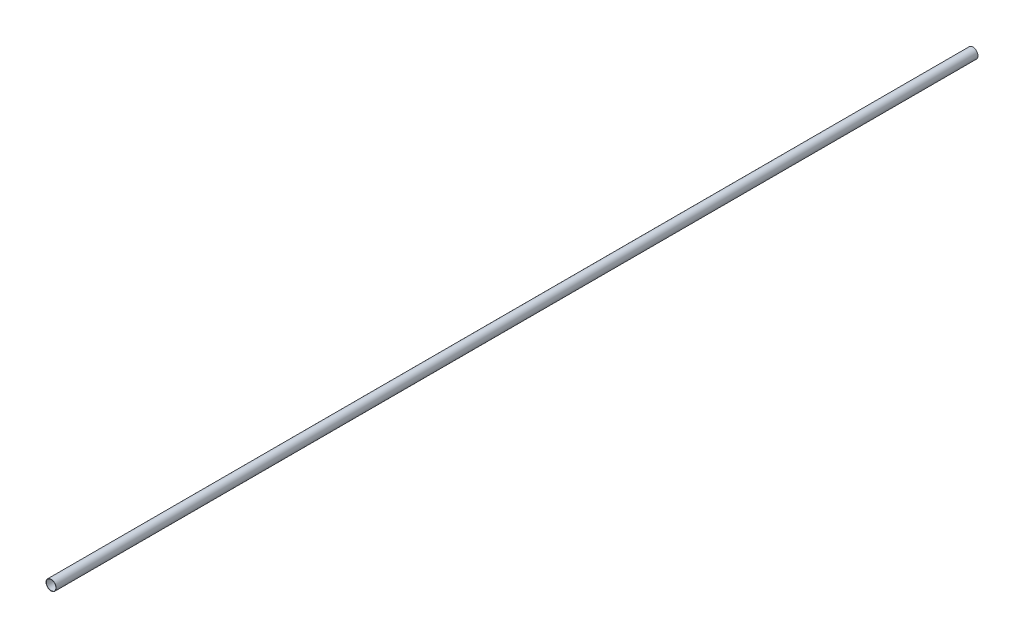
from build123d import *

# Parameters (mm, degrees)
SKETCH1_R           = 4.572
SKETCH1_R_2         = 4.318
BOSS_EXTRUDE1_DEPTH = 825.5


with BuildPart() as part:
    # Sketch1 → Boss-Extrude1 (new body)
    with BuildSketch(Plane.XY):
        with Locations((-112.482767201, -112.482767201)):
            Circle(SKETCH1_R)
        with Locations((-112.482767201, -112.482767201)):
            Circle(SKETCH1_R_2, mode=Mode.SUBTRACT)
    extrude(amount=BOSS_EXTRUDE1_DEPTH)


solid = part.part
